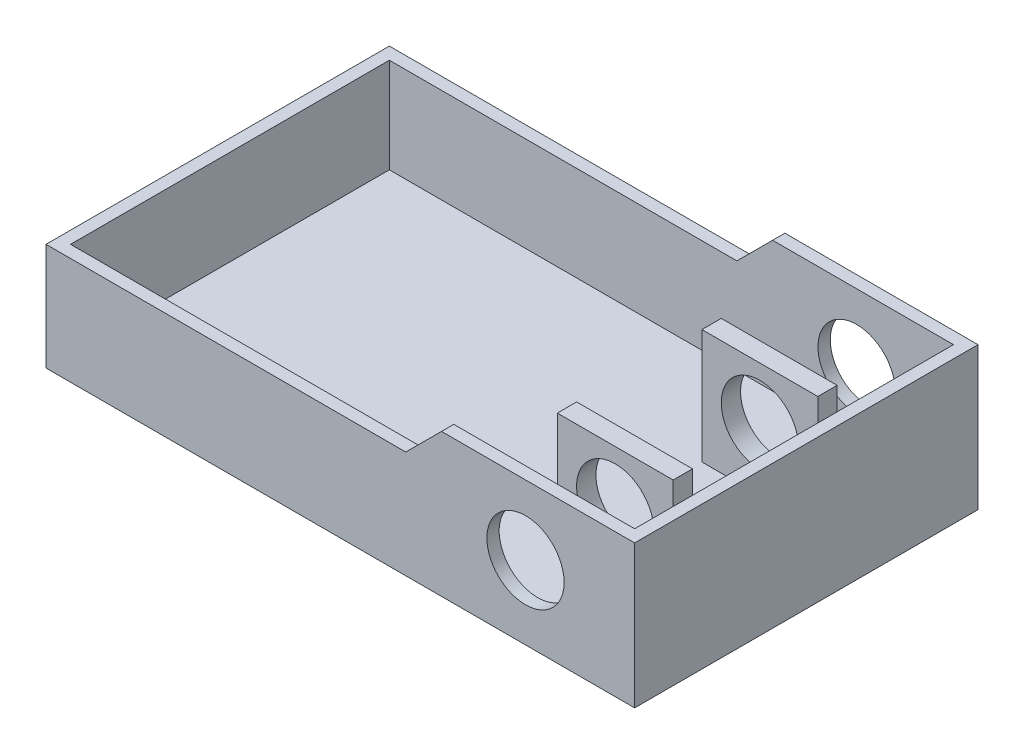
from build123d import *

# Parameters (mm, degrees)
SKETCH1_W           = 304.8
SKETCH1_H           = 74
BOSS_EXTRUDE1_DEPTH = 177.8
SHELL1_T            = -6.35
SKETCH2_R           = 20
CUT_EXTRUDE1_DEPTH  = 200
BOSS_EXTRUDE2_START = -46.45
SKETCH3_W           = 60
SKETCH3_H           = 65.75
SKETCH3_R           = 20
BOSS_EXTRUDE2_DEPTH = 10
CUT_EXTRUDE2_DEPTH  = 238.081420613


with BuildPart() as part:
    # Sketch1 → Boss-Extrude1 (new body)
    with BuildSketch(Plane.XY):
        Rectangle(SKETCH1_W, SKETCH1_H)
    extrude(amount=BOSS_EXTRUDE1_DEPTH)

    # Shell1
    shell1_openings = [part.faces().sort_by_distance(p)[0] for p in [
        (0, 37, 88.9),
    ]]
    offset(amount=SHELL1_T, openings=shell1_openings, kind=Kind.INTERSECTION)

    # Sketch2 → Cut-Extrude1 (cut)
    with BuildSketch(Plane.XY.offset(177.8)):
        with Locations((95.9, 1)):
            Circle(SKETCH2_R)
    extrude(amount=-CUT_EXTRUDE1_DEPTH, mode=Mode.SUBTRACT)

    # Sketch3 → Boss-Extrude2 (add)
    with BuildSketch(Plane.XY.offset(177.8).offset(BOSS_EXTRUDE2_START)):
        with Locations((95.9, -4.125)):
            Rectangle(SKETCH3_W, SKETCH3_H)
        with Locations((95.9, 1)):
            Circle(SKETCH3_R, mode=Mode.SUBTRACT)
    boss_extrude2 = extrude(amount=-BOSS_EXTRUDE2_DEPTH)

    # Mirror1: Boss-Extrude2 across plane
    add(boss_extrude2.mirror(Plane(origin=(0, 0, 88.9), x_dir=(1, 0, 0), z_dir=(0, 0, -1))))

    # Sketch5 → Cut-Extrude2 (cut, through all)
    with BuildSketch(Plane.XY.offset(177.8)):
        Polygon((52.4, 37), (33.9, 18.5), (-152.4, 18.5), (-152.4, 37), align=None)
    extrude(amount=-CUT_EXTRUDE2_DEPTH, mode=Mode.SUBTRACT)


solid = part.part
